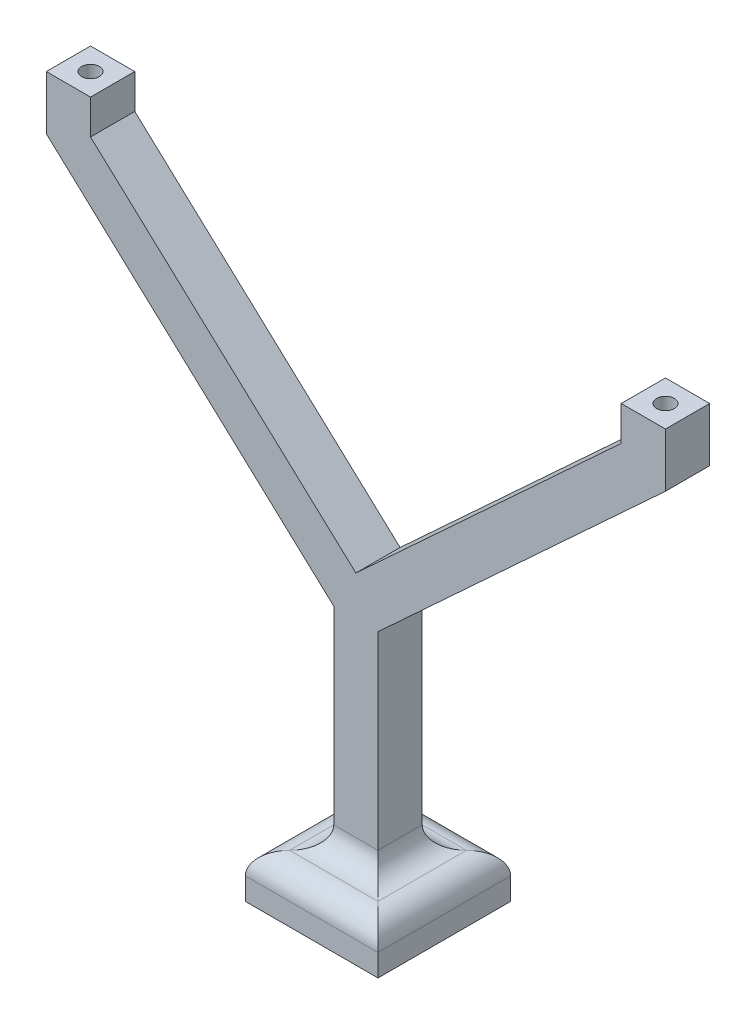
from build123d import *

# Parameters (mm, degrees)
BOSS_EXTRUDE3_DEPTH = 5
SKETCH32_W          = 10
SKETCH32_H          = 10
BOSS_EXTRUDE5_DEPTH = 57.810843841
SKETCH33_W          = 30
SKETCH33_H          = 30
BOSS_EXTRUDE6_DEPTH = 10
FILLET2_R           = 5
SKETCH34_R          = 2
CUT_EXTRUDE2_DEPTH  = 4


with BuildPart() as part:
    # Sketch11 → Boss-Extrude3 (new, symmetric)
    with BuildSketch(Plane.XY):
        Polygon((-70, 130), (-70, 117.810843841), (0, 53.195459226), (70, 117.810843841), (70, 130), (60, 130), (60, 122.189156159), (0, 66.804540774), (-60, 122.189156159), (-60, 130), align=None)
    extrude(amount=BOSS_EXTRUDE3_DEPTH, both=True)

    # Sketch32 → Boss-Extrude5 (add)
    with BuildSketch(Plane(origin=(0, 0, 0), x_dir=(1, 0, 0), z_dir=(0, 1, 0))):
        Rectangle(SKETCH32_W, SKETCH32_H)
    extrude(amount=BOSS_EXTRUDE5_DEPTH)

    # Sketch33 → Boss-Extrude6 (add)
    with BuildSketch(Plane.XZ):
        Rectangle(SKETCH33_W, SKETCH33_H)
    extrude(amount=-BOSS_EXTRUDE6_DEPTH)

    # Fillet2
    fillet2_edges = [part.edges().sort_by_distance(p)[0] for p in [
        (-5, 10, 0),
        (0, 10, -5),
        (15, 10, 0),
        (0, 10, -15),
        (-15, 10, 0),
        (0, 10, 15),
        (0, 10, 5),
        (5, 10, 0),
    ]]
    fillet(fillet2_edges, radius=FILLET2_R - 0.0001)  # a hair under: the kernel refuses the full size

    # Sketch34 → Cut-Extrude2 (cut)
    with BuildSketch(Plane(origin=(0, 130, 0), x_dir=(1, 0, 0), z_dir=(0, 1, 0))):
        with Locations(Location((-65, 0, 0), (0, 0, 270))):
            Circle(SKETCH34_R)
        with Locations(Location((65, 0, 0), (0, 0, 270))):
            Circle(SKETCH34_R)
    extrude(amount=-CUT_EXTRUDE2_DEPTH, mode=Mode.SUBTRACT)


solid = part.part
